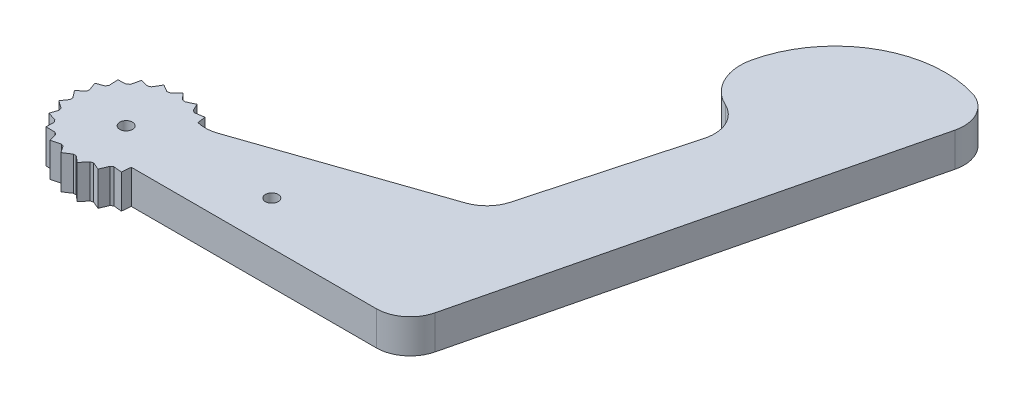
from build123d import *

# Parameters (mm, degrees)
SKETCH1_R           = 1.190625
BOSS_EXTRUDE1_DEPTH = 6.35
FILLET1_R           = 6.35


with BuildPart() as part:
    # Sketch1 → Boss-Extrude1 (new body)
    with BuildSketch(Plane(origin=(0, 0, 0), x_dir=(1, 0, 0), z_dir=(0, 1, 0))):
        with BuildLine():
            Line((-29.821169202, -13.660880054), (20.978830798, -13.660880054))
            Line((20.978830798, -13.660880054), (42.395952597, 74.352713283))
            ThreePointArc((42.395952597, 74.352713283), (23.25712174, 76.338412105), (10.802994012, 61.671014622))
            ThreePointArc((10.802994012, 61.671014622), (13.079862123, 53.776279051), (20.951622371, 51.421206075))
            Line((20.951622371, 51.421206075), (10.410154917, 12.910611329))
            Line((10.410154917, 12.910611329), (-29.996286473, -0.999994782))
            ThreePointArc((-29.996286473, -0.999994782), (-30.398101975, -0.586570963), (-30.824193291, -0.198213985))
            Line((-30.824193291, -0.198213985), (-31.044454647, 1.322241923))
            Line((-31.044454647, 1.322241923), (-32.73765618, 1.076955714))
            ThreePointArc((-32.73765618, 1.076955714), (-32.976313311, 1.193094592), (-33.218113701, 1.302538808))
            Line((-33.218113701, 1.302538808), (-33.874715297, 2.691486458))
            Line((-33.874715297, 2.691486458), (-35.421467347, 1.960285492))
            ThreePointArc((-35.421467347, 1.960285492), (-35.683694268, 2.001303864), (-35.946962256, 2.035000026))
            Line((-35.946962256, 2.035000026), (-36.982128516, 3.170223372))
            Line((-36.982128516, 3.170223372), (-38.246329537, 2.017447359))
            ThreePointArc((-38.246329537, 2.017447359), (-38.509052422, 1.979735943), (-38.770622576, 1.934719064))
            Line((-38.770622576, 1.934719064), (-40.093267325, 2.716327725))
            Line((-40.093267325, 2.716327725), (-40.963677954, 1.243411538))
            ThreePointArc((-40.963677954, 1.243411538), (-41.203779335, 1.130288631), (-41.440635618, 1.010519829))
            Line((-41.440635618, 1.010519829), (-42.934376923, 1.369738627))
            Line((-42.934376923, 1.369738627), (-43.334408136, -0.293713141))
            ThreePointArc((-43.334408136, -0.293713141), (-43.530761052, -0.472293647), (-43.722062046, -0.656275697))
            Line((-43.722062046, -0.656275697), (-45.255462875, -0.751055081))
            Line((-45.255462875, -0.751055081), (-45.149915191, -2.458672264))
            ThreePointArc((-45.149915191, -2.458672264), (-45.285242191, -2.686996744), (-45.414154972, -2.919003123))
            Line((-45.414154972, -2.919003123), (-46.852288576, -3.459440878))
            Line((-46.852288576, -3.459440878), (-46.250449331, -5.060967113))
            ThreePointArc((-46.250449331, -5.060967113), (-46.312842744, -5.318944878), (-46.368024039, -5.57856092))
            Line((-46.368024039, -5.57856092), (-47.58434641, -6.517102938))
            Line((-47.58434641, -6.517102938), (-46.539172541, -7.871616999))
            ThreePointArc((-46.539172541, -7.871616999), (-46.523142255, -8.136548112), (-46.499736562, -8.400929727))
            Line((-46.499736562, -8.400929727), (-47.387221268, -9.654991978))
            Line((-47.387221268, -9.654991978), (-45.990679537, -10.643307692))
            ThreePointArc((-45.990679537, -10.643307692), (-45.897636087, -10.89188038), (-45.797702915, -11.137764145))
            Line((-45.797702915, -11.137764145), (-46.278258552, -12.596999395))
            Line((-46.278258552, -12.596999395), (-44.653233223, -13.132153052))
            ThreePointArc((-44.653233223, -13.132153052), (-44.491363673, -13.34249495), (-44.323696325, -13.548245102))
            Line((-44.323696325, -13.548245102), (-44.355037921, -15.084252569))
            Line((-44.355037921, -15.084252569), (-42.644517948, -15.11915502))
            ThreePointArc((-42.644517948, -15.11915502), (-42.428065496, -15.272757758), (-42.207417329, -15.420269965))
            Line((-42.207417329, -15.420269965), (-41.78678708, -16.897893539))
            Line((-41.78678708, -16.897893539), (-40.141284249, -16.429473653))
            ThreePointArc((-40.141284249, -16.429473653), (-39.889294943, -16.512821445), (-39.635081193, -16.589115838))
            Line((-39.635081193, -16.589115838), (-38.799491125, -17.878336715))
            Line((-38.799491125, -17.878336715), (-37.363796242, -16.947811616))
            ThreePointArc((-37.363796242, -16.947811616), (-37.098443082, -16.953570537), (-36.833032482, -16.951933832))
            Line((-36.833032482, -16.951933832), (-35.656007696, -17.939311107))
            Line((-35.656007696, -17.939311107), (-34.556450183, -16.628559402))
            ThreePointArc((-34.556450183, -16.628559402), (-34.301082079, -16.556222714), (-34.047828595, -16.476798928))
            Line((-34.047828595, -16.476798928), (-32.632937655, -17.075451466))
            Line((-32.632937655, -17.075451466), (-31.966269592, -15.499808597))
            ThreePointArc((-31.966269592, -15.499808597), (-31.743356851, -15.355741339), (-31.52454472, -15.205519116))
            Line((-31.52454472, -15.205519116), (-29.996286473, -15.362770384))
            Line((-29.996286473, -15.362770384), (-29.821169202, -13.660880054))
        make_face()
        with Locations(Location((-37.024468694, -7.428857796, 0), (0, 0, 270))):
            Circle(SKETCH1_R, mode=Mode.SUBTRACT)
        with Locations(Location((-11.697065196, -5.509839295, 0), (0, 0, 270))):
            Circle(SKETCH1_R, mode=Mode.SUBTRACT)
    extrude(amount=BOSS_EXTRUDE1_DEPTH)

    # Fillet1
    # the kernel refuses this fillet: 6.35 mm, written as the material it adds along each edge
    with BuildSketch(Plane(origin=(-29.996286473, 0, 0.999994782), x_dir=(0.9455362039998026, 0, -0.3255169533613324), z_dir=(0, 1, 0))) as fillet1_piece_1:
        with BuildLine():
            CenterArc((2.941509547, 6.35), FILLET1_R, 236.94754351, 33.05245649)
            ThreePointArc((-0.521822628, 1.027610476), (-0.245354643, 0.521704946), (0, 0))
            Line((0, 0), (2.941509547, 0))
        make_face()
    extrude(amount=6.35)
    with BuildSketch(Plane(origin=(10.410154917, 0, -12.910611329), x_dir=(0.2640166060846216, 0, -0.9645181344648517), z_dir=(0, 1, 0))) as fillet1_piece_2:
        with BuildLine():
            CenterArc((FILLET1_R * 0.528295396262, FILLET1_R), FILLET1_R, 214.305424952, 55.694575048)
            Line((-FILLET1_R * 0.297749538039, FILLET1_R * 0.436395735897), (0, 0))
            Line((0, 0), (FILLET1_R * 0.528295396262, 0))
        make_face()
    extrude(amount=6.35)
    with BuildSketch(Plane(origin=(20.951622371, 0, -51.421206075), x_dir=(-0.9938958560926382, 0, -0.11032237869934564), z_dir=(0, 1, 0))) as fillet1_piece_3:
        with BuildLine():
            CenterArc((7.380811015, 6.028648653), FILLET1_R, 171.02537205, 80.668791662)
            Line((1.108550782, 7.019230085), (0, 0))
            ThreePointArc((0, 0), (2.693172408, 0.433927926), (5.386344816, 0))
        make_face()
    extrude(amount=6.35)
    # the kernel refuses this fillet: 6.35 mm, written as the material it takes off along each edge
    with BuildSketch(Plane(origin=(20.978830798, -12.475246836, 13.660880054), x_dir=(-1, 0, 0), z_dir=(0, 1, 0))) as fillet1_2_piece_1:
        with BuildLine():
            CenterArc((FILLET1_R * 0.785842320361, -FILLET1_R), FILLET1_R, 90, 76.323524065)
            Line((-FILLET1_R * 0.185803956952, -FILLET1_R * 0.763560765133), (0, 0))
            Line((0, 0), (FILLET1_R * 0.785842320361, 0))
        make_face()
    extrude(amount=31.300493671, mode=Mode.SUBTRACT)
    with BuildSketch(Plane(origin=(42.395952597, -15.381047636, -74.352713283), x_dir=(-0.23643923486666696, 0, 0.9716462773127189), z_dir=(0, 1, 0))) as fillet1_2_piece_2:
        with BuildLine():
            CenterArc((5.118829866, -6.35), FILLET1_R, 90, 87.108005414)
            ThreePointArc((-1.223082878, -6.029620925), (-0.837554928, -2.968964591), (0, 0))
            Line((0, 0), (5.118829866, 0))
        make_face()
    extrude(amount=37.112095273, mode=Mode.SUBTRACT)


solid = part.part
